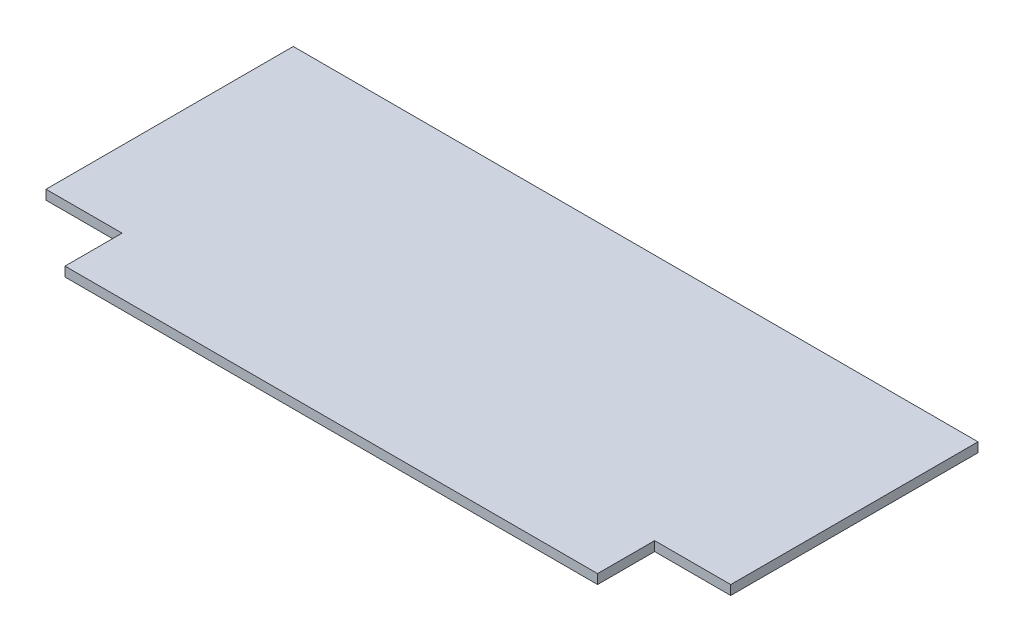
from build123d import *

# Parameters (mm, degrees)
SKETCH1_W           = 457.2
SKETCH1_H           = 203.2
BOSS_EXTRUDE1_DEPTH = 6.35
SKETCH2_W           = 50.8
SKETCH2_H           = 38.1
CUT_EXTRUDE1_DEPTH  = 251.24156829


with BuildPart() as part:
    # Sketch1 → Boss-Extrude1 (new body)
    with BuildSketch(Plane(origin=(0, 0, 0), x_dir=(1, 0, 0), z_dir=(0, 1, 0))):
        Rectangle(SKETCH1_W, SKETCH1_H)
    extrude(amount=BOSS_EXTRUDE1_DEPTH)

    # Sketch2 → Cut-Extrude1 (cut, through all)
    with BuildSketch(Plane(origin=(0, 6.35, 0), x_dir=(1, 0, 0), z_dir=(0, 1, 0))):
        with Locations((-203.2, -82.55)):
            Rectangle(SKETCH2_W, SKETCH2_H)
        with Locations((203.2, -82.55)):
            Rectangle(SKETCH2_W, SKETCH2_H)
    extrude(amount=-CUT_EXTRUDE1_DEPTH, mode=Mode.SUBTRACT)


solid = part.part
